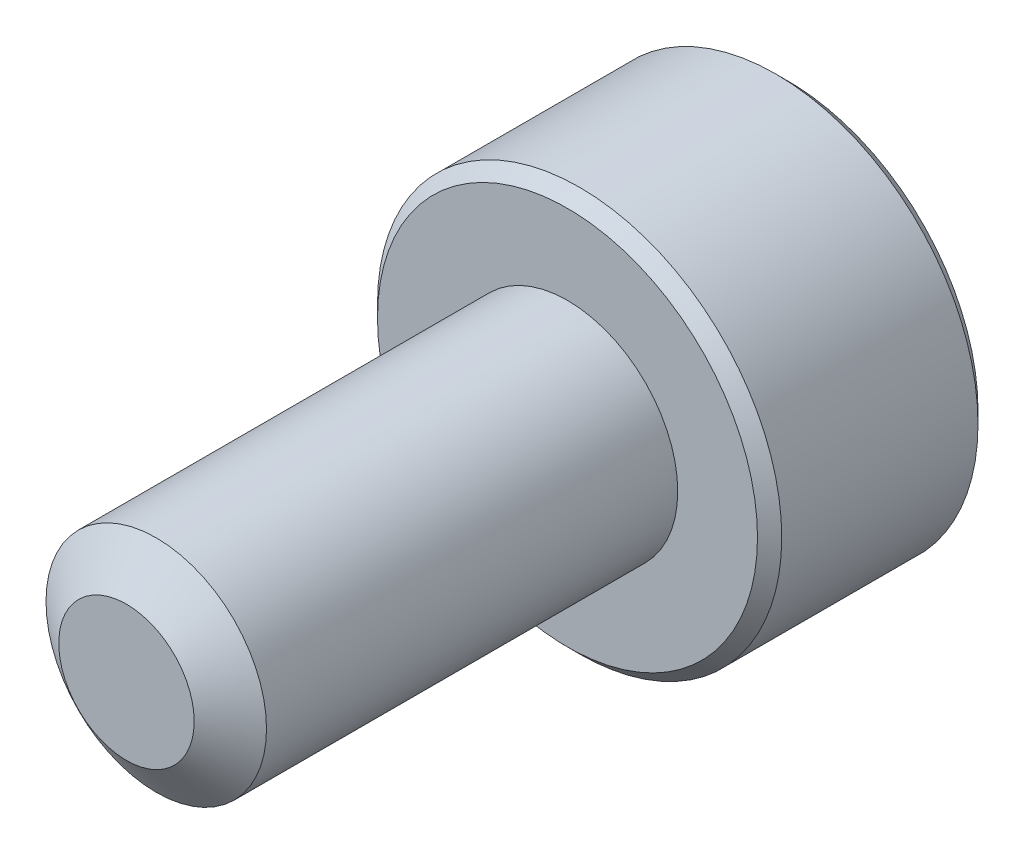
from build123d import *

# Parameters (mm, degrees)
SKETCH1_R          = 1.5
EXTRUDE1_DEPTH     = 6
SKETCH6_R          = 2.75
EXTRUDE2_DEPTH     = 3
CUT_EXTRUDE1_DEPTH = 1.875
CHAMFER1_SIZE      = 0.165


with BuildPart() as part:
    # Sketch1 → Extrude1 (new body)
    with BuildSketch(Plane.XY):
        Circle(SKETCH1_R)
    extrude(amount=-EXTRUDE1_DEPTH)

    # Sketch4 → Cut-Revolve1 (revolve, cut)
    with BuildSketch(Plane(origin=(0, 0, 0), x_dir=(0, 0, -1), z_dir=(1, 0, 0))):
        Polygon((0.405251783, 1.5), (0, 0.921240474), (0, 1.5), align=None)
    revolve(axis=Axis((0, 0, 0), (0, 0, -1)), mode=Mode.SUBTRACT)

    # Sketch6 → Extrude2 (add)
    with BuildSketch(Plane(origin=(0, 0, -6), x_dir=(-1, 0, 0), z_dir=(0, 0, -1))):
        Circle(SKETCH6_R)
    extrude(amount=EXTRUDE2_DEPTH)

    # Sketch7 → Cut-Extrude1 (cut)
    with BuildSketch(Plane(origin=(0, 0, -9), x_dir=(-1, 0, 0), z_dir=(0, 0, -1))):
        Polygon((0, 1.443375673), (-1.25, 0.721687836), (-1.25, -0.721687836), (0, -1.443375673), (1.25, -0.721687836), (1.25, 0.721687836), align=None)
    extrude(amount=-CUT_EXTRUDE1_DEPTH, mode=Mode.SUBTRACT)

    # Cut-Extrude2 cone 1 section (through the dimple's axis) → Cut-Extrude2 (revolve, cut)
    with BuildSketch(Plane(origin=(0, 0, -9), x_dir=(0, 1, 0), z_dir=(1, 0, 0))):
        Polygon((0, 0), (1.443375673, 0), (0, 1.443375673), align=None)
    revolve(axis=Axis((0, 0, -9), (0, 0, 1)), mode=Mode.SUBTRACT)

    # Chamfer1
    chamfer1_edges = [part.edges().sort_by_distance(p)[0] for p in [
        (2.75, 0, -9),
        (2.75, 0, -6),
    ]]
    chamfer(chamfer1_edges, length=CHAMFER1_SIZE)

    # Sketch10 → Revolve1 (revolve)
    with BuildSketch(Plane(origin=(0, 0, 0), x_dir=(0, 0, -1), z_dir=(1, 0, 0))):
        Polygon((6, 1.5), (6, 0), (5.253679656, 0), (5.875, 1.5), align=None)
    revolve(axis=Axis((0, 0, -6), (0, 0, 1)))


solid = part.part
